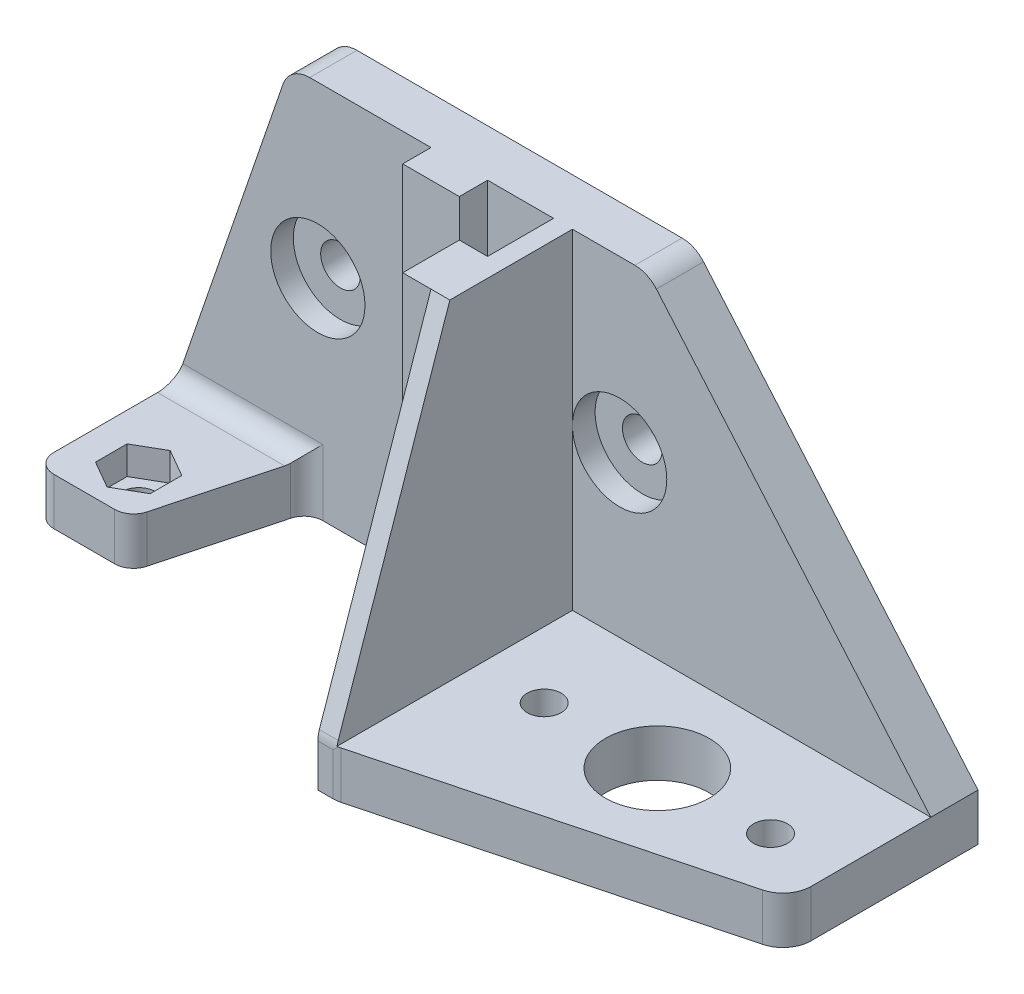
from build123d import *

# Parameters (mm, degrees)
SKETCH1_W           = 80
SKETCH1_H           = 30
BOSS_EXTRUDE1_DEPTH = 5
SKETCH2_W           = 20
SKETCH2_H           = 25
CUT_EXTRUDE1_DEPTH  = 86.586213843
BOSS_EXTRUDE2_DEPTH = 35
SKETCH4_R           = 5.5
SKETCH4_R_2         = 1.8
CUT_EXTRUDE2_DEPTH  = 93.330926563
CHAMFER1_SIZE       = 38
CHAMFER1_SIZE2      = 10
FILLET1_R           = 3
SKETCH5_R           = 2.1
CUT_EXTRUDE3_DEPTH  = 95.339811321
SKETCH6_R           = 5
CUT_EXTRUDE4_DEPTH  = 2.4
CHAMFER2_SIZE       = 35
CHAMFER2_SIZE2      = 30
FILLET2_R           = 3
SKETCH7_W           = 6
SKETCH7_H           = 3
SKETCH7_W_2         = 3
SKETCH7_H_2         = 6
BOSS_EXTRUDE3_DEPTH = 40
CHAMFER3_SIZE       = 35
CHAMFER3_SIZE2      = 12
FILLET3_R           = 3
CHAMFER4_SIZE       = 35
CHAMFER4_SIZE2      = 12
FILLET4_R           = 3
SKETCH8_R           = 1.8
CUT_EXTRUDE5_DEPTH  = 95.339811321
CUT_EXTRUDE6_DEPTH  = 93.330926563
FILLET5_R           = 2
CUT_EXTRUDE7_DEPTH  = 3


with BuildPart() as part:
    # Sketch1 → Boss-Extrude1 (new body)
    with BuildSketch(Plane(origin=(0, 0, 0), x_dir=(1, 0, 0), z_dir=(0, 1, 0))):
        with Locations((-40, 15)):
            Rectangle(SKETCH1_W, SKETCH1_H)
    extrude(amount=BOSS_EXTRUDE1_DEPTH)

    # Sketch2 → Cut-Extrude1 (cut, through all)
    with BuildSketch(Plane(origin=(0, 5, 0), x_dir=(1, 0, 0), z_dir=(0, 1, 0))):
        with Locations((-50, 12.5)):
            Rectangle(SKETCH2_W, SKETCH2_H)
    extrude(amount=-CUT_EXTRUDE1_DEPTH, mode=Mode.SUBTRACT)

    # Sketch3 → Boss-Extrude2 (add)
    with BuildSketch(Plane(origin=(0, 5, 0), x_dir=(1, 0, 0), z_dir=(0, 1, 0))):
        Polygon((-80, 30), (0, 30), (0, 25), (-38, 25), (-38, 0), (-40, 0), (-40, 25), (-80, 25), align=None)
    extrude(amount=BOSS_EXTRUDE2_DEPTH)

    # Sketch4 → Cut-Extrude2 (cut, through all)
    with BuildSketch(Plane(origin=(0, 5, 0), x_dir=(1, 0, 0), z_dir=(0, 1, 0))):
        with Locations(Location((-19, 15, 0), (0, 0, 270))):
            Circle(SKETCH4_R)
        with Locations(Location((-7, 15, 0), (0, 0, 270))):
            Circle(SKETCH4_R_2)
        with Locations(Location((-31, 15, 0), (0, 0, 270))):
            Circle(SKETCH4_R_2)
    extrude(amount=-CUT_EXTRUDE2_DEPTH, mode=Mode.SUBTRACT)

    # Chamfer1
    chamfer1_edges = [part.edges().sort_by_distance(p)[0] for p in [
        (0, 2.5, 0),
    ]]
    chamfer1_side = [part.faces().sort_by_distance(p)[0] for p in [
        (-20, 0.565685425, 0),
    ]]
    chamfer(chamfer1_edges, length=CHAMFER1_SIZE, length2=CHAMFER1_SIZE2, reference=chamfer1_side[0])

    # Fillet1
    fillet1_edges = [part.edges().sort_by_distance(p)[0] for p in [
        (0, 2.5, -10),
    ]]
    fillet(fillet1_edges, radius=FILLET1_R)

    # Sketch5 → Cut-Extrude3 (cut, through all)
    with BuildSketch(Plane(origin=(0, 0, -30), x_dir=(-1, 0, 0), z_dir=(0, 0, -1))):
        with Locations((33, 22)):
            Circle(SKETCH5_R)
        with Locations((65, 22)):
            Circle(SKETCH5_R)
    extrude(amount=-CUT_EXTRUDE3_DEPTH, mode=Mode.SUBTRACT)

    # Sketch6 → Cut-Extrude4 (cut)
    with BuildSketch(Plane.XY.offset(-25)):
        with Locations((-33, 22)):
            Circle(SKETCH6_R)
        with Locations((-65, 22)):
            Circle(SKETCH6_R)
    extrude(amount=-CUT_EXTRUDE4_DEPTH, mode=Mode.SUBTRACT)

    # Chamfer2
    chamfer2_edges = [part.edges().sort_by_distance(p)[0] for p in [
        (0, 40, -27.5),
    ]]
    chamfer2_side = [part.faces().sort_by_distance(p)[0] for p in [
        (0, 15.78592553, -25.370407315),
    ]]
    chamfer(chamfer2_edges, length=CHAMFER2_SIZE, length2=CHAMFER2_SIZE2, reference=chamfer2_side[0])

    # Fillet2
    fillet2_edges = [part.edges().sort_by_distance(p)[0] for p in [
        (-30, 40, -27.5),
    ]]
    fillet(fillet2_edges, radius=FILLET2_R)

    # Sketch7 → Boss-Extrude3 (add)
    with BuildSketch(Plane.XZ):
        with Locations((-50, -23.5)):
            Rectangle(SKETCH7_W, SKETCH7_H)
        with Locations((-41.5, -15)):
            Rectangle(SKETCH7_W_2, SKETCH7_H_2)
    extrude(amount=-BOSS_EXTRUDE3_DEPTH)

    # Chamfer3
    chamfer3_edges = [part.edges().sort_by_distance(p)[0] for p in [
        (-39, 40, 0),
    ]]
    chamfer3_side = [part.faces().sort_by_distance(p)[0] for p in [
        (-39, 20, 0),
    ]]
    chamfer(chamfer3_edges, length=CHAMFER3_SIZE, length2=CHAMFER3_SIZE2, reference=chamfer3_side[0])

    # Fillet3
    # the kernel refuses this fillet: 3 mm, written as the material it takes off along each edge
    with BuildSketch(Plane(origin=(-36.75, 5, 0), x_dir=(0, 0.945945945945946, -0.3243243243243238), z_dir=(-1, 0, 0))) as fillet3_piece_1:
        with BuildLine():
            CenterArc((FILLET3_R * 0.166666666667, FILLET3_R), FILLET3_R, 251.075355584, 18.924644416)
            Line((-FILLET3_R * 0.157657657658, FILLET3_R * 0.0540540540541), (0, 0))
            Line((0, 0), (FILLET3_R * 0.166666666667, 0))
        make_face()
    extrude(amount=4.5, mode=Mode.SUBTRACT)
    with BuildSketch(Plane(origin=(-38, -0.970324057, 0), x_dir=(-1, 0, 0), z_dir=(0, 1, 0))) as fillet3_piece_2:
        with BuildLine():
            CenterArc((FILLET3_R * 0.129376540878, -FILLET3_R), FILLET3_R, 90, 14.743562836)
            Line((-FILLET3_R * 0.125116758402, -FILLET3_R * 0.0329254627374), (0, 0))
            Line((0, 0), (FILLET3_R * 0.129376540878, 0))
        make_face()
    extrude(amount=6.940648113, mode=Mode.SUBTRACT)

    # Chamfer4
    chamfer4_edges = [part.edges().sort_by_distance(p)[0] for p in [
        (-80, 40, -27.5),
    ]]
    chamfer4_side = [part.faces().sort_by_distance(p)[0] for p in [
        (-80, 2.5, -0.5),
    ]]
    chamfer(chamfer4_edges, length=CHAMFER4_SIZE, length2=CHAMFER4_SIZE2, reference=chamfer4_side[0])

    # Fillet4
    fillet4_edges = [part.edges().sort_by_distance(p)[0] for p in [
        (-68, 40, -27.5),
    ]]
    fillet(fillet4_edges, radius=FILLET4_R)

    # Sketch8 → Cut-Extrude5 (cut, through all)
    with BuildSketch(Plane.XZ):
        with Locations(Location((-74, -15, 0), (0, 0, 270))):
            Circle(SKETCH8_R)
    extrude(amount=-CUT_EXTRUDE5_DEPTH, mode=Mode.SUBTRACT)

    # Sketch9 → Cut-Extrude6 (cut, through all)
    with BuildSketch(Plane(origin=(0, 5, 0), x_dir=(1, 0, 0), z_dir=(0, 1, 0))):
        Polygon((-80, 10), (-70, 10), (-66, 25), (-60, 25), (-60, 0), (-80, 0), align=None)
    extrude(amount=-CUT_EXTRUDE6_DEPTH, mode=Mode.SUBTRACT)

    # Fillet5
    fillet5_edges = [part.edges().sort_by_distance(p)[0] for p in [
        (-80, 2.5, -10),
        (-70, 2.5, -10),
        (-66, 2.5, -25),
        (-73, 5, -25),
    ]]
    fillet(fillet5_edges, radius=FILLET5_R)

    # Sketch10 → Cut-Extrude7 (cut)
    with BuildSketch(Plane(origin=(0, 5, 0), x_dir=(1, 0, 0), z_dir=(0, 1, 0))):
        Polygon((-71.1, 13.325684219), (-71.1, 16.674315781), (-74, 18.348631561), (-76.9, 16.674315781), (-76.9, 13.325684219), (-74, 11.651368439), align=None)
    extrude(amount=-CUT_EXTRUDE7_DEPTH, mode=Mode.SUBTRACT)


solid = part.part
